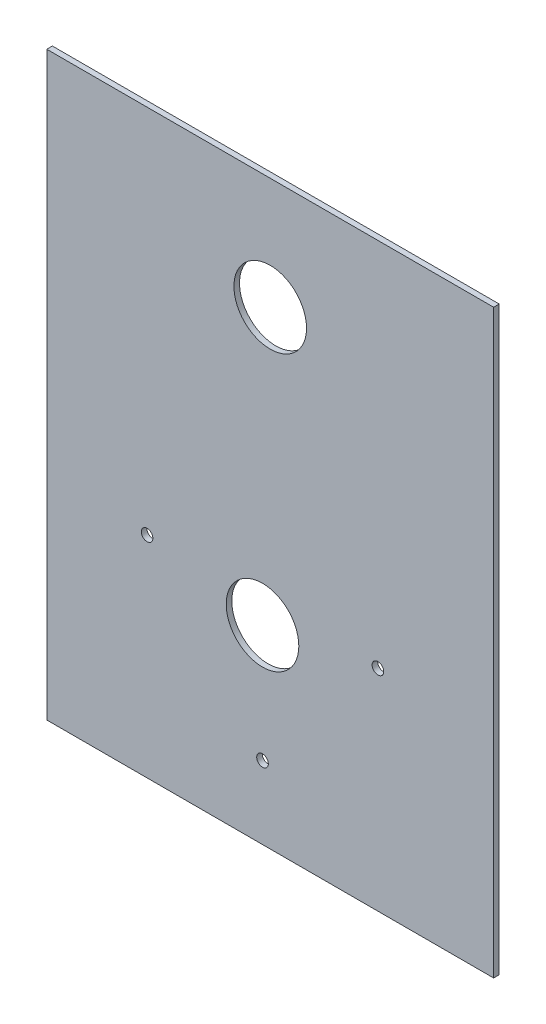
from build123d import *

# Parameters (mm, degrees)
SKETCH1_W           = 254
SKETCH1_H           = 330.2
BOSS_EXTRUDE1_DEPTH = 3.175
SKETCH2_R           = 20.6375
CUT_EXTRUDE1_DEPTH  = 301.262663605
SKETCH3_R           = 3.3
SKETCH3_R_2         = 20.6375
CUT_EXTRUDE2_DEPTH  = 301.262663605


with BuildPart() as part:
    # Sketch1 → Boss-Extrude1 (new body)
    with BuildSketch(Plane.XY):
        with Locations((19.981406387, -96.70919141)):
            Rectangle(SKETCH1_W, SKETCH1_H)
    extrude(amount=-BOSS_EXTRUDE1_DEPTH)

    # Sketch2 → Cut-Extrude1 (cut, through all)
    with BuildSketch(Plane.XY):
        with Locations((19.981406387, 4.89080859)):
            Circle(SKETCH2_R)
    extrude(amount=-CUT_EXTRUDE1_DEPTH, mode=Mode.SUBTRACT)

    # Sketch3 → Cut-Extrude2 (cut, through all)
    with BuildSketch(Plane.XY):
        with Locations((-50.007395692, -142.229557515)):
            Circle(SKETCH3_R)
        with Locations((81.218237397, -142.229557515)):
            Circle(SKETCH3_R)
        with Locations((15.605420852, -220.423867352)):
            Circle(SKETCH3_R)
        with Locations((15.605420852, -153.798867352)):
            Circle(SKETCH3_R_2)
    extrude(amount=-CUT_EXTRUDE2_DEPTH, mode=Mode.SUBTRACT)


solid = part.part
